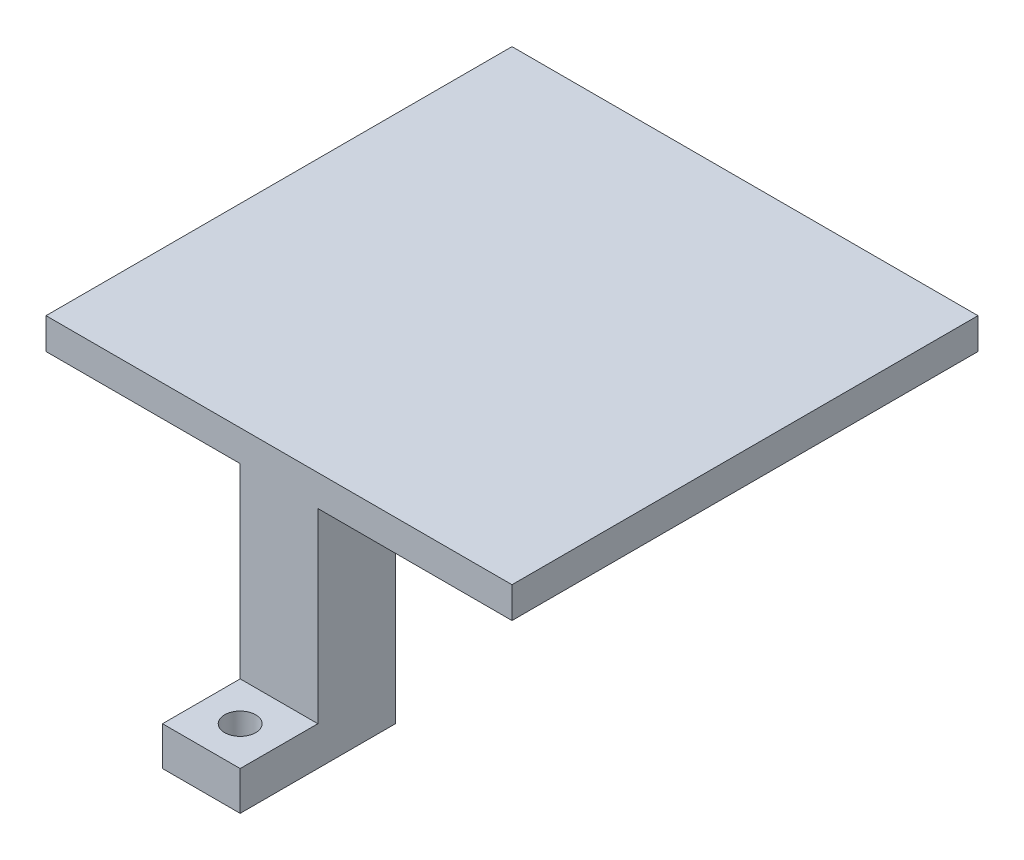
from build123d import *

# Parameters (mm, degrees)
SKETCH1_W           = 30
SKETCH1_H           = 30
BOSS_EXTRUDE1_DEPTH = 2
BOSS_EXTRUDE2_DEPTH = 14.5
SKETCH3_W           = 5
SKETCH3_H           = 2.5
BOSS_EXTRUDE3_DEPTH = 5
SKETCH4_R           = 1
CUT_EXTRUDE1_DEPTH  = 5


with BuildPart() as part:
    # Sketch1 → Boss-Extrude1 (new body)
    with BuildSketch(Plane(origin=(0, 0, 0), x_dir=(1, 0, 0), z_dir=(0, 1, 0))):
        Rectangle(SKETCH1_W, SKETCH1_H)
    extrude(amount=BOSS_EXTRUDE1_DEPTH)

    # Sketch2 → Boss-Extrude2 (add)
    with BuildSketch(Plane.XZ):
        Polygon((2.5, 15), (0, 15), (-2.5, 15), (-2.5, 10), (2.5, 10), align=None)
    extrude(amount=BOSS_EXTRUDE2_DEPTH)

    # Sketch3 → Boss-Extrude3 (add)
    with BuildSketch(Plane.XY.offset(15)):
        with Locations((0, -13.25)):
            Rectangle(SKETCH3_W, SKETCH3_H)
    extrude(amount=BOSS_EXTRUDE3_DEPTH)

    # Sketch4 → Cut-Extrude1 (cut)
    with BuildSketch(Plane(origin=(0, -14.5, 0), x_dir=(-1, 0, 0), z_dir=(0, -1, 0))):
        with Locations((0, -17.5)):
            Circle(SKETCH4_R)
    extrude(amount=-CUT_EXTRUDE1_DEPTH, mode=Mode.SUBTRACT)


solid = part.part
